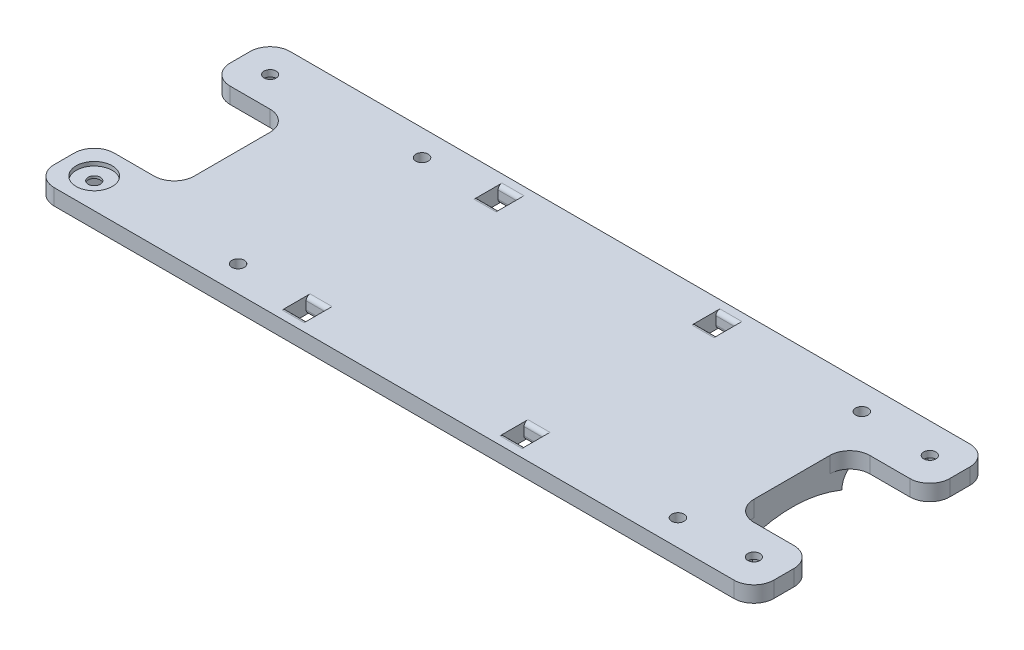
from build123d import *

# Parameters (mm, degrees)
BOSS_EXTRUDE1_DEPTH = 4
SKETCH2_R           = 1.55
CUT_EXTRUDE3_DEPTH  = 130.223312929
FILLET1_R           = 5
SKETCH5_R           = 1.525
CUT_EXTRUDE4_DEPTH  = 10
SKETCH5_3_R         = 4.5
CUT_EXTRUDE5_DEPTH  = 1
CUT_EXTRUDE6_DEPTH  = 2.4
SKETCH8_W           = 140
SKETCH8_H           = 25
BOSS_EXTRUDE4_DEPTH = 5
CUT_EXTRUDE7_DEPTH  = 186.792392805
FILLET5_R           = 5
SKETCH12_W          = 5.5
SKETCH12_H          = 5
CUT_EXTRUDE8_DEPTH  = 10
FILLET6_R           = 1


with BuildPart() as part:
    # Sketch1 → Boss-Extrude1 (new body)
    with BuildSketch(Plane(origin=(0, 0, 0), x_dir=(1, 0, 0), z_dir=(0, 1, 0))):
        Polygon((-94.307015775, 45.137931034), (-94.307015775, 16.137931034), (-114.307015775, 16.137931034), (-114.307015775, 1.137931034), (-68.307015775, 1.137931034), (45.692984225, 1.137931034), (65.692984225, 1.137931034), (65.692984225, 16.137931034), (45.692984225, 16.137931034), (45.692984225, 45.137931034), (65.692984225, 45.137931034), (65.692984225, 60.137931034), (45.692984225, 60.137931034), (-68.307015775, 60.137931034), (-114.307015775, 60.137931034), (-114.307015775, 45.137931034), align=None)
    extrude(amount=BOSS_EXTRUDE1_DEPTH)

    # Sketch2 → Cut-Extrude3 (cut, through all)
    with BuildSketch(Plane(origin=(0, 4, 0), x_dir=(1, 0, 0), z_dir=(0, 1, 0))):
        with Locations(Location((40.192984225, 53.637931034, 0), (0, 0, 270))):
            Circle(SKETCH2_R)
        with Locations(Location((-69.807015775, 53.637931034, 0), (0, 0, 270))):
            Circle(SKETCH2_R)
        with Locations(Location((-69.807015775, 7.637931034, 0), (0, 0, 270))):
            Circle(SKETCH2_R)
        with Locations(Location((40.192984225, 7.637931034, 0), (0, 0, 270))):
            Circle(SKETCH2_R)
    extrude(amount=-CUT_EXTRUDE3_DEPTH, mode=Mode.SUBTRACT)

    # Fillet1
    fillet1_edges = [part.edges().sort_by_distance(p)[0] for p in [
        (65.692984225, 2, -60.137931034),
        (65.692984225, 2, -45.137931034),
        (45.692984225, 2, -45.137931034),
        (45.692984225, 2, -16.137931034),
        (65.692984225, 2, -16.137931034),
        (65.692984225, 2, -1.137931034),
        (-114.307015775, 2, -1.137931034),
        (-114.307015775, 2, -16.137931034),
        (-94.307015775, 2, -16.137931034),
        (-94.307015775, 2, -45.137931034),
        (-114.307015775, 2, -45.137931034),
        (-114.307015775, 2, -60.137931034),
    ]]
    fillet(fillet1_edges, radius=FILLET1_R)

    # Sketch5 → Cut-Extrude4 (cut)
    with BuildSketch(Plane(origin=(0, 4, 0), x_dir=(1, 0, 0), z_dir=(0, 1, 0))):
        with Locations(Location((-106.807015775, 52.637931034, 0), (0, 0, 270))):
            Circle(SKETCH5_R)
        with Locations(Location((-106.807015775, 8.637931034, 0), (0, 0, 270))):
            Circle(SKETCH5_R)
        with Locations(Location((58.192984225, 8.637931034, 0), (0, 0, 270))):
            Circle(SKETCH5_R)
        with Locations(Location((58.192984225, 52.637931034, 0), (0, 0, 270))):
            Circle(SKETCH5_R)
    extrude(amount=-CUT_EXTRUDE4_DEPTH, mode=Mode.SUBTRACT)

    # Sketch5<3> → Cut-Extrude5 (cut)
    with BuildSketch(Plane(origin=(0, 4, 0), x_dir=(1, 0, 0), z_dir=(0, 1, 0))):
        with Locations(Location((-106.807015775, 8.637931034, 0), (0, 0, 270))):
            Circle(SKETCH5_3_R)
    extrude(amount=-CUT_EXTRUDE5_DEPTH, mode=Mode.SUBTRACT)

    # Sketch6 → Cut-Extrude6 (cut)
    with BuildSketch(Plane.XZ):
        Polygon((-104.663016346, -11.019268148), (-103.672717625, -7.97184162), (-105.816717054, -5.590504507), (-108.951015204, -6.256593921), (-109.941313925, -9.304020449), (-107.797314496, -11.685357562), align=None)
        Polygon((58.770092174, -11.789826721), (61.211159934, -9.714088733), (60.634051985, -6.562193047), (57.615876277, -5.486035348), (55.174808517, -7.561773336), (55.751916465, -10.713669022), align=None)
        Polygon((60.682419613, -50.620454529), (57.690516013, -49.473278495), (55.201080626, -51.490755001), (55.703548838, -54.65540754), (58.695452437, -55.802583574), (61.184887825, -53.785107068), align=None)
        Polygon((-103.606959923, -52.473181078), (-105.349665496, -49.784226396), (-108.549721348, -49.948976352), (-110.007071626, -52.802680991), (-108.264366053, -55.491635673), (-105.064310202, -55.326885717), align=None)
    extrude(amount=-CUT_EXTRUDE6_DEPTH, mode=Mode.SUBTRACT)

    # Sketch8 → Boss-Extrude4 (add)
    with BuildSketch(Plane.XZ):
        with Locations((-24.307015775, -30.637931034)):
            Rectangle(SKETCH8_W, SKETCH8_H)
    extrude(amount=BOSS_EXTRUDE4_DEPTH)

    # Sketch9 → Cut-Extrude7 (cut, through all)
    with BuildSketch(Plane(origin=(-94.307015775, 0, -95.444946809), x_dir=(0, 0, -1), z_dir=(1, 0, 0))):
        with BuildLine():
            Line((-52.307015775, -5), (-77.307015775, -5))
            add(Edge.make_bspline(
                [(-52.307015775, -5), (-64.731276491, 0.028189696), (-77.307015775, -5)],
                knots=[0, 0, 0, 1, 1, 1], degree=2))
        make_face()
    extrude(amount=CUT_EXTRUDE7_DEPTH, mode=Mode.SUBTRACT)

    # Fillet5
    fillet5_edges = [part.edges().sort_by_distance(p)[0] for p in [
        (-24.307015775, 0, -43.137931034),
        (-24.307015775, 0, -18.137931034),
    ]]
    fillet(fillet5_edges, radius=FILLET5_R - 0.0001)  # a hair under: the kernel refuses the full size

    # Sketch12 → Cut-Extrude8 (cut)
    with BuildSketch(Plane.XZ):
        with Locations((-51.557015775, -6.637931034)):
            Rectangle(SKETCH12_W, SKETCH12_H)
        with Locations((2.942984225, -6.637931034)):
            Rectangle(SKETCH12_W, SKETCH12_H)
        with Locations((2.942984225, -54.637931034)):
            Rectangle(SKETCH12_W, SKETCH12_H)
        with Locations((-51.557015775, -54.637931034)):
            Rectangle(SKETCH12_W, SKETCH12_H)
    extrude(amount=-CUT_EXTRUDE8_DEPTH, mode=Mode.SUBTRACT)

    # Fillet6
    fillet6_edges = [part.edges().sort_by_distance(p)[0] for p in [
        (-51.557015775, 4, -9.137931034),
        (-51.557015775, 4, -4.137931034),
        (-51.557015775, 0, -9.137931034),
        (-51.557015775, 0, -4.137931034),
        (-51.557015775, 4, -52.137931034),
        (-51.557015775, 4, -57.137931034),
        (2.942984225, 4, -52.137931034),
        (2.942984225, 4, -57.137931034),
        (2.942984225, 4, -9.137931034),
        (2.942984225, 4, -4.137931034),
        (2.942984225, 0, -4.137931034),
        (2.942984225, 0, -9.137931034),
        (2.942984225, 0, -52.137931034),
        (2.942984225, 0, -57.137931034),
        (-51.557015775, 0, -57.137931034),
        (-51.557015775, 0, -52.137931034),
    ]]
    fillet(fillet6_edges, radius=FILLET6_R)


solid = part.part
